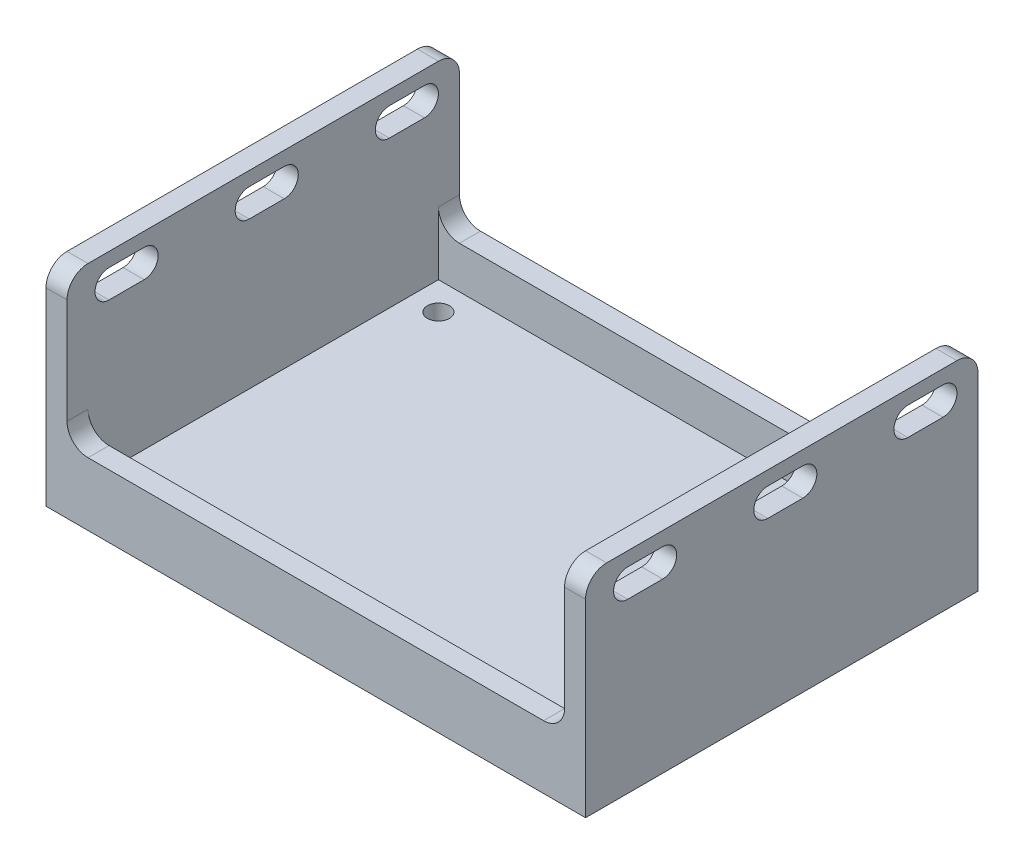
from build123d import *

# Parameters (mm, degrees)
SKETCH1_W           = 71
SKETCH1_H           = 50
SKETCH1_R           = 1.575
BOSS_EXTRUDE1_DEPTH = 3
SKETCH2_W           = 77
SKETCH2_H           = 56
SKETCH2_W_2         = 71
SKETCH2_H_2         = 50
BOSS_EXTRUDE2_DEPTH = 30
SKETCH3_W           = 71
SKETCH3_H           = 30
CUT_EXTRUDE1_DEPTH  = 75.284924446
CUT_EXTRUDE2_DEPTH  = 88.252507127
FILLET1_R           = 3


with BuildPart() as part:
    # Sketch1 → Boss-Extrude1 (new body)
    with BuildSketch(Plane(origin=(0, 0, 0), x_dir=(1, 0, 0), z_dir=(0, 1, 0))):
        Rectangle(SKETCH1_W, SKETCH1_H)
        with Locations((-31.5, 21)):
            Circle(SKETCH1_R, mode=Mode.SUBTRACT)
        with Locations((31.5, 21)):
            Circle(SKETCH1_R, mode=Mode.SUBTRACT)
        with Locations((31.5, -21)):
            Circle(SKETCH1_R, mode=Mode.SUBTRACT)
        with Locations((-31.5, -21)):
            Circle(SKETCH1_R, mode=Mode.SUBTRACT)
    extrude(amount=BOSS_EXTRUDE1_DEPTH)

    # Sketch2 → Boss-Extrude2 (add)
    with BuildSketch(Plane(origin=(0, 0, 0), x_dir=(1, 0, 0), z_dir=(0, 1, 0))):
        Rectangle(SKETCH2_W, SKETCH2_H)
        Rectangle(SKETCH2_W_2, SKETCH2_H_2, mode=Mode.SUBTRACT)
    extrude(amount=BOSS_EXTRUDE2_DEPTH)

    # Sketch3 → Cut-Extrude1 (cut, through all)
    with BuildSketch(Plane(origin=(0, 0, -28), x_dir=(-1, 0, 0), z_dir=(0, 0, -1))):
        with Locations((0, 24)):
            Rectangle(SKETCH3_W, SKETCH3_H)
    extrude(amount=-CUT_EXTRUDE1_DEPTH, mode=Mode.SUBTRACT)

    # Sketch4 → Cut-Extrude2 (cut, through all)
    with BuildSketch(Plane.ZY.offset(38.5)):
        with BuildLine():
            Line((-18, 24), (-23, 24))
            ThreePointArc((-23, 24), (-25, 26), (-23, 28))
            Line((-23, 28), (-18, 28))
            ThreePointArc((-18, 28), (-16, 26), (-18, 24))
        make_face()
        with BuildLine():
            Line((2, 28), (-3, 28))
            ThreePointArc((-3, 28), (-5, 26), (-3, 24))
            Line((-3, 24), (2, 24))
            ThreePointArc((2, 24), (4, 26), (2, 28))
        make_face()
        with BuildLine():
            Line((22, 28), (17, 28))
            ThreePointArc((17, 28), (15, 26), (17, 24))
            Line((17, 24), (22, 24))
            ThreePointArc((22, 24), (24, 26), (22, 28))
        make_face()
    extrude(amount=-CUT_EXTRUDE2_DEPTH, mode=Mode.SUBTRACT)

    # Fillet1
    fillet1_edges = [part.edges().sort_by_distance(p)[0] for p in [
        (-37, 30, 28),
        (-37, 30, -28),
        (37, 30, 28),
        (37, 30, -28),
        (-35.5, 9, -26.5),
        (-35.5, 9, 26.5),
        (35.5, 9, 26.5),
        (35.5, 9, -26.5),
    ]]
    fillet(fillet1_edges, radius=FILLET1_R)


solid = part.part
